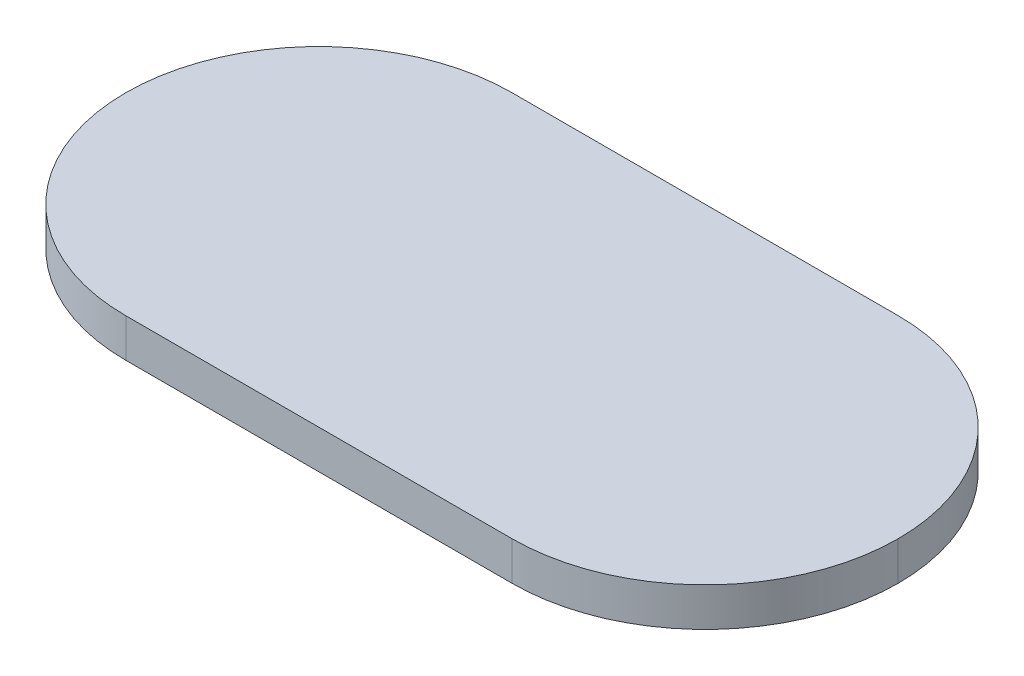
from build123d import *

# Parameters (mm, degrees)
SKETCH1_W           = 200
SKETCH1_H           = 100
BOSS_EXTRUDE1_DEPTH = 10
FILLET1_R           = 50


with BuildPart() as part:
    # Sketch1 → Boss-Extrude1 (new body)
    with BuildSketch(Plane(origin=(0, 0, 0), x_dir=(1, 0, 0), z_dir=(0, 1, 0))):
        Rectangle(SKETCH1_W, SKETCH1_H)
    extrude(amount=BOSS_EXTRUDE1_DEPTH)

    # Fillet1
    fillet1_edges = [part.edges().sort_by_distance(p)[0] for p in [
        (100, 5, -50),
        (100, 5, 50),
        (-100, 5, 50),
        (-100, 5, -50),
    ]]
    fillet(fillet1_edges, radius=FILLET1_R - 0.0001)  # a hair under: the kernel refuses the full size


solid = part.part
